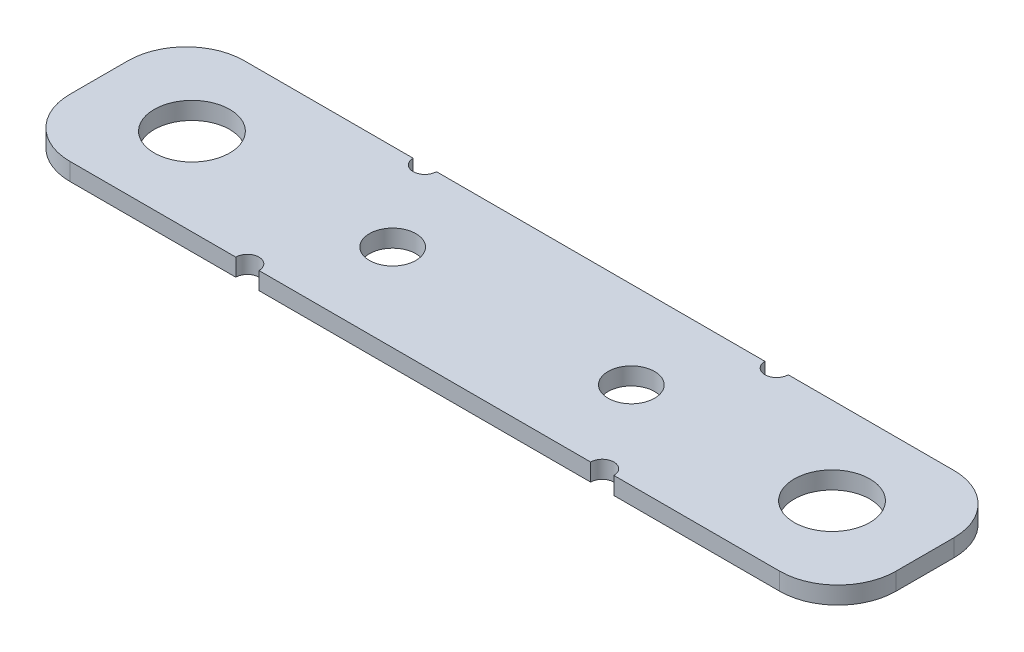
from build123d import *

# Parameters (mm, degrees)
SM_BASE_FLANGE_2_DEPTH      = 15
SKETCH_26_R                 = 3.25
CUT_EXTRUDE_1_DEPTH         = 42.400483089
FILLET_1_R                  = 5
CUT_EXTRUDE_2_OUTLINE_W     = 33
CUT_EXTRUDE_2_OUTLINE_H     = 15
CUT_EXTRUDE_2_OUTLINE_R     = 2
CUT_EXTRUDE_2_DEPTH         = 20
CUT_EXTRUDE_START           = -1.5
CUT_EXTRUDE_2_2_OUTLINE_R   = 2
CUT_EXTRUDE_2_2_DEPTH       = 1.5
CUT_EXTRUDE_2_3_OUTLINE_R   = 2
CUT_EXTRUDE_2_3_OUTLINE_R_2 = 3.25
CUT_EXTRUDE_2_3_DEPTH       = 1.5


# Read off the part's stored shape, not the designer's step: Вырез-Вытянуть2
# Sheet-metal steps are written as plain solids
with BuildPart() as part:
    # Эскиз1 → Базовая кромка2 (new body)
    with BuildSketch(Plane.XY):
        with BuildLine():
            Line((0, 20), (0, 1.5))
            ThreePointArc((0, 1.5), (0.439339828, 0.439339828), (1.5, 0))
            Line((1.5, 0), (28.5, 0))
            ThreePointArc((28.5, 0), (29.560660172, 0.439339828), (30, 1.5))
            Line((30, 1.5), (30, 20))
            Line((30, 20), (31.5, 20))
            Line((31.5, 20), (31.5, 1.5))
            ThreePointArc((31.5, 1.5), (30.621320344, -0.621320344), (28.5, -1.5))
            Line((28.5, -1.5), (1.5, -1.5))
            ThreePointArc((1.5, -1.5), (-0.621320344, -0.621320344), (-1.5, 1.5))
            Line((-1.5, 1.5), (-1.5, 20))
            Line((-1.5, 20), (0, 20))
        make_face()
    extrude(amount=SM_BASE_FLANGE_2_DEPTH)

    # Эскиз26 → Вырез-Вытянуть1 (cut, through all)
    with BuildSketch(Plane(origin=(31.5, 0, 0), x_dir=(0, 0, -1), z_dir=(1, 0, 0))):
        with Locations((-7.5, 12)):
            Circle(SKETCH_26_R)
    extrude(amount=-CUT_EXTRUDE_1_DEPTH, mode=Mode.SUBTRACT)

    # Скругление1
    fillet_1_edges = [part.edges().sort_by_distance(p)[0] for p in [
        (-0.75, 20, 0),
        (30.75, 20, 0),
        (-0.75, 20, 15),
        (30.75, 20, 15),
    ]]
    fillet(fillet_1_edges, radius=FILLET_1_R)

    # Вырез-Вытянуть2 outline → Вырез-Вытянуть2 (cut)
    with BuildSketch(Plane(origin=(0, 0, 0), x_dir=(1, 0, 0), z_dir=(0, 1, 0))):
        with Locations((15, -7.5)):
            Rectangle(CUT_EXTRUDE_2_OUTLINE_W, CUT_EXTRUDE_2_OUTLINE_H)
        with Locations((25.267145868, -7.5)):
            Circle(CUT_EXTRUDE_2_OUTLINE_R, mode=Mode.SUBTRACT)
        with Locations((4.732854132, -7.5)):
            Circle(CUT_EXTRUDE_2_OUTLINE_R, mode=Mode.SUBTRACT)
    extrude(amount=CUT_EXTRUDE_2_DEPTH, mode=Mode.SUBTRACT)

    # Cut-Extrude 2 2 outline → Cut-Extrude 2 2 (cut)
    with BuildSketch(Plane(origin=(0, 0, 0), x_dir=(1, 0, 0), z_dir=(0, 1, 0)).offset(CUT_EXTRUDE_START)):
        with BuildLine():
            ThreePointArc((31.267145868, -15), (30.267145868, -14), (29.267145868, -15))
            Line((29.267145868, -15), (31.267145868, -15))
        make_face()
        with BuildLine():
            Line((31.267145868, 0), (29.267145868, 0))
            ThreePointArc((29.267145868, 0), (30.267145868, -1), (31.267145868, 0))
        make_face()
        with BuildLine():
            ThreePointArc((0.732854132, -15), (-0.267145868, -14), (-1.267145868, -15))
            Line((-1.267145868, -15), (0.732854132, -15))
        make_face()
        with BuildLine():
            Line((1, 0), (-1, 0))
            ThreePointArc((-1, 0), (0, -1), (1, 0))
        make_face()
        with Locations((25.267145868, -7.5)):
            Circle(CUT_EXTRUDE_2_2_OUTLINE_R)
        with Locations((4.732854132, -7.5)):
            Circle(CUT_EXTRUDE_2_2_OUTLINE_R)
    extrude(amount=CUT_EXTRUDE_2_2_DEPTH, mode=Mode.SUBTRACT)

    # Cut-Extrude 2 3 outline → Cut-Extrude 2 3 (add)
    with BuildSketch(Plane(origin=(0, 0, 0), x_dir=(1, 0, 0), z_dir=(0, 1, 0)).offset(CUT_EXTRUDE_START)):
        with BuildLine():
            Line((31.267145868, -15), (45.534291735, -15))
            ThreePointArc((45.534291735, -15), (49.069825641, -13.535533906), (50.534291735, -10))
            Line((50.534291735, -10), (50.534291735, -5))
            ThreePointArc((50.534291735, -5), (49.069825641, -1.464466094), (45.534291735, 0))
            Line((45.534291735, 0), (31.267145868, 0))
            ThreePointArc((31.267145868, 0), (30.267145868, -1), (29.267145868, 0))
            Line((29.267145868, 0), (1, 0))
            ThreePointArc((1, 0), (0, -1), (-1, 0))
            Line((-1, 0), (-15.534291735, 0))
            ThreePointArc((-15.534291735, 0), (-19.069825641, -1.464466094), (-20.534291735, -5))
            Line((-20.534291735, -5), (-20.534291735, -10))
            ThreePointArc((-20.534291735, -10), (-19.069825641, -13.535533906), (-15.534291735, -15))
            Line((-15.534291735, -15), (-1.267145868, -15))
            ThreePointArc((-1.267145868, -15), (-0.267145868, -14), (0.732854132, -15))
            Line((0.732854132, -15), (29.267145868, -15))
            ThreePointArc((29.267145868, -15), (30.267145868, -14), (31.267145868, -15))
        make_face()
        with Locations((25.267145868, -7.5)):
            Circle(CUT_EXTRUDE_2_3_OUTLINE_R, mode=Mode.SUBTRACT)
        with Locations((4.732854132, -7.5)):
            Circle(CUT_EXTRUDE_2_3_OUTLINE_R, mode=Mode.SUBTRACT)
        with Locations((42.534291735, -7.5)):
            Circle(CUT_EXTRUDE_2_3_OUTLINE_R_2, mode=Mode.SUBTRACT)
        with Locations((-12.534291735, -7.5)):
            Circle(CUT_EXTRUDE_2_3_OUTLINE_R_2, mode=Mode.SUBTRACT)
    extrude(amount=CUT_EXTRUDE_2_3_DEPTH)


solid = part.part
